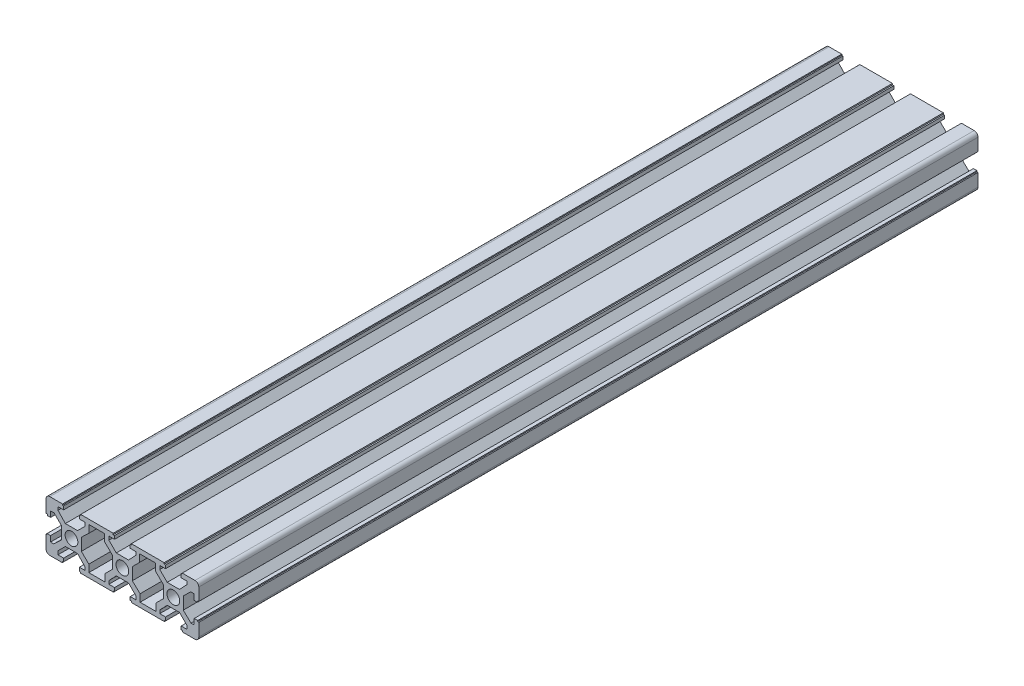
from build123d import *

# Parameters (mm, degrees)
SKETCH1_R           = 2.5
BOSS_EXTRUDE1_DEPTH = 306
FILLET1_R           = 1.5


with BuildPart() as part:
    # Sketch1 → Boss-Extrude1 (new body)
    with BuildSketch(Plane.XY):
        Polygon((-11.499994592, 10), (-8.499996602, 10), (-3.599996602, 10), (-3.599996602, 9.479132912), (-3.075, 9.479132912), (-3.075, 8.2), (-5.304654122, 8.2), (-5.304654122, 6.8), (-2.404654122, 3.9), (2.404654122, 3.9), (5.304654122, 6.94037733), (5.304654122, 8.2), (3.075004761, 8.2), (3.075004761, 9.565763355), (3.497475148, 9.573137603), (3.497475148, 10), (8.397475148, 10), (11.500004761, 10), (16.400004761, 10), (16.400004761, 9.479132912), (16.925004761, 9.479132912), (16.925004761, 8.199999224), (14.695350639, 8.199999224), (14.695350639, 6.799999224), (17.595350639, 3.899999224), (22.404658882, 3.899999224), (25.304658882, 6.940376554), (25.304658882, 8.199999348), (23.075004761, 8.199999348), (23.075004761, 9.565762703), (23.497475148, 9.573136951), (23.497475148, 9.999999348), (28.397475148, 9.999999348), (30.000004761, 10), (30.000004761, 8.503508491), (30.000004761, 8.500000005), (30.000003571, 3.600001911), (29.479140586, 3.600002038), (29.479140459, 3.075002038), (28.200007547, 3.075002348), (28.200008088, 5.30465647), (26.800008088, 5.30465681), (23.900007384, 2.404657514), (23.900006216, -2.404650729), (26.940382842, -5.304651467), (28.200005512, -5.304651773), (28.200006053, -3.074997652), (29.565769408, -3.074997983), (29.573143553, -3.497468372), (30.000005951, -3.497468476), (30.000004761, -8.397468476), (30.000004761, -10), (28.500006962, -10), (23.600006962, -9.99999881), (23.600007089, -9.479131722), (23.075007089, -9.479131595), (23.0750074, -8.199998683), (25.304658882, -8.199999224), (25.304658882, -6.8), (22.404658882, -3.9), (17.595350639, -3.9), (14.695350639, -6.94037733), (14.695350639, -8.2), (16.925004761, -8.2), (16.925004761, -9.565763355), (16.502534374, -9.573137603), (16.502534374, -10), (11.602534374, -10), (8.500006962, -10), (3.600006962, -9.99999881), (3.600007089, -9.479131722), (3.075007089, -9.479131595), (3.0750074, -8.199998683), (5.304654122, -8.199999224), (5.304654122, -6.8), (2.404654122, -3.9), (-2.404654122, -3.9), (-5.304654122, -6.94037733), (-5.304654122, -8.2), (-3.075, -8.2), (-3.075, -9.565763355), (-3.497470387, -9.573137603), (-3.497470387, -10), (-8.397470387, -10), (-11.602529613, -10), (-16.502528178, -10), (-16.502528178, -9.573137078), (-16.925, -9.565763355), (-16.925, -8.2), (-14.695345878, -8.2), (-14.695345878, -6.94037733), (-17.595345878, -3.9), (-22.404654122, -3.9), (-25.304654122, -6.8), (-25.304654122, -8.2), (-23.075, -8.2), (-23.075, -9.479132912), (-23.600003398, -9.479132912), (-23.600003398, -10), (-28.500001921, -10), (-30, -10), (-30, -3.497471822), (-29.573137078, -3.497471822), (-29.565763355, -3.075), (-28.2, -3.075), (-28.2, -5.304654122), (-26.94037733, -5.304654122), (-23.9, -2.404654122), (-23.9, 2.404654122), (-26.8, 5.304654122), (-28.2, 5.304654122), (-28.2, 3.075), (-29.479132912, 3.075), (-29.479132912, 3.600003398), (-30, 3.600003398), (-30, 10), (-23.497471822, 10), (-23.497471822, 9.573137078), (-23.075, 9.565763355), (-23.075, 8.2), (-25.304654122, 8.2), (-25.304654122, 6.94037733), (-22.404654122, 3.9), (-17.595345878, 3.9), (-14.695345878, 6.8), (-14.695345878, 8.2), (-16.925, 8.2), (-16.925, 9.479132912), (-16.399996602, 9.479132912), (-16.399996602, 10), align=None)
        with Locations((-20, 0)):
            Circle(SKETCH1_R, mode=Mode.SUBTRACT)
        with Locations(Location((20, 0, 0), (0, 0, 180))):
            Circle(SKETCH1_R, mode=Mode.SUBTRACT)
        with Locations(Location((0, 0, 0), (0, 0, 180))):
            Circle(SKETCH1_R, mode=Mode.SUBTRACT)
        Polygon((-13.05962267, 5.304654122), (-13.05962267, 8.2), (-6.94037733, 8.2), (-6.94037733, 5.304654122), (-3.9, 2.404654122), (-3.9, -2.404654122), (-6.8, -5.304654122), (-6.8, -8.2), (-13.2, -8.2), (-13.2, -5.304654122), (-16.1, -2.404654122), (-16.1, 2.404654122), align=None, mode=Mode.SUBTRACT)
        Polygon((6.800008088, 5.304656034), (6.800008088, 8.199999224), (10.000004761, 8.199999224), (13.05962743, 8.199999224), (13.05962743, 5.304653346), (16.100004761, 2.404653346), (16.100004761, -2.404654898), (13.200004761, -5.304654898), (13.200004761, -8.2), (10.000004761, -8.2), (6.940382842, -8.2), (6.940382842, -5.304652243), (3.900006216, -2.404651505), (3.900007384, 2.404656738), align=None, mode=Mode.SUBTRACT)
    extrude(amount=BOSS_EXTRUDE1_DEPTH)

    # Fillet1
    fillet1_edges = [part.edges().sort_by_distance(p)[0] for p in [
        (30.000004761, 10, 153),
        (30.000004761, -10, 153),
        (-30, -10, 153),
        (-30, 10, 153),
    ]]
    fillet(fillet1_edges, radius=FILLET1_R - 0.0001)  # a hair under: the kernel refuses the full size


solid = part.part
